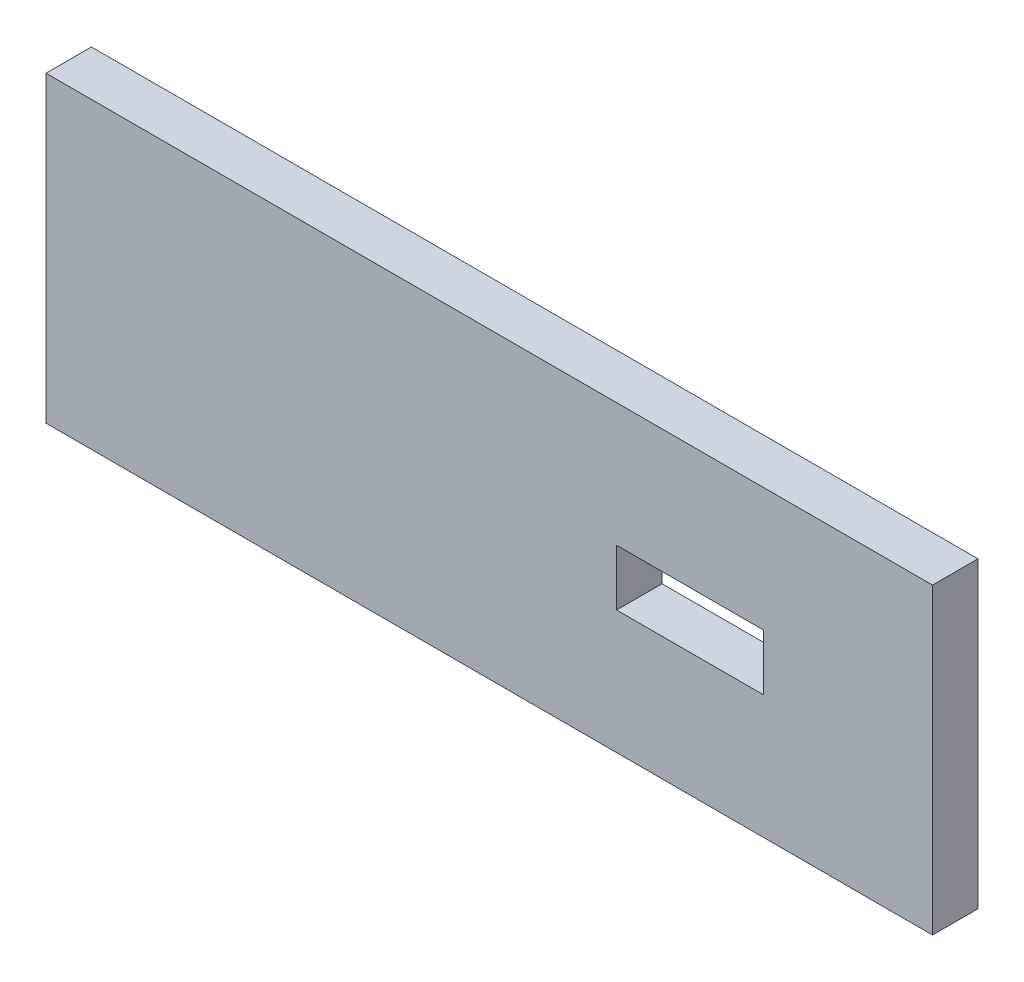
from build123d import *

# Parameters (mm, degrees)
EXTRUDE_1_DEPTH      = 10
EXTRUDE_1_DEPTH_BACK = 10
SKETCH_1_W           = 58.5
SKETCH_1_H           = 3
SKETCH_1_3_W         = 9.7
SKETCH_1_3_H         = 3
CUT_EXTRUDE_1_DEPTH  = 1.85


with BuildPart() as part:
    # 草圖1 → 填料-伸長1 (new, two sides: drawn at the far end of the back side and taken through both)
    with BuildSketch(Plane(origin=(0, 0, 0), x_dir=(1, 0, 0), z_dir=(0, 1, 0)).offset(-EXTRUDE_1_DEPTH_BACK)):
        with Locations((-24.00631853, -18.7)):
            Rectangle(SKETCH_1_W, SKETCH_1_H)
    extrude(amount=EXTRUDE_1_DEPTH + EXTRUDE_1_DEPTH_BACK)

    # 草圖1<3> → 除料-伸長1 (cut, symmetric)
    with BuildSketch(Plane(origin=(0, 0, 0), x_dir=(1, 0, 0), z_dir=(0, 1, 0))):
        with Locations((-10.75631853, -18.7)):
            Rectangle(SKETCH_1_3_W, SKETCH_1_3_H)
    extrude(amount=CUT_EXTRUDE_1_DEPTH, both=True, mode=Mode.SUBTRACT)


solid = part.part
